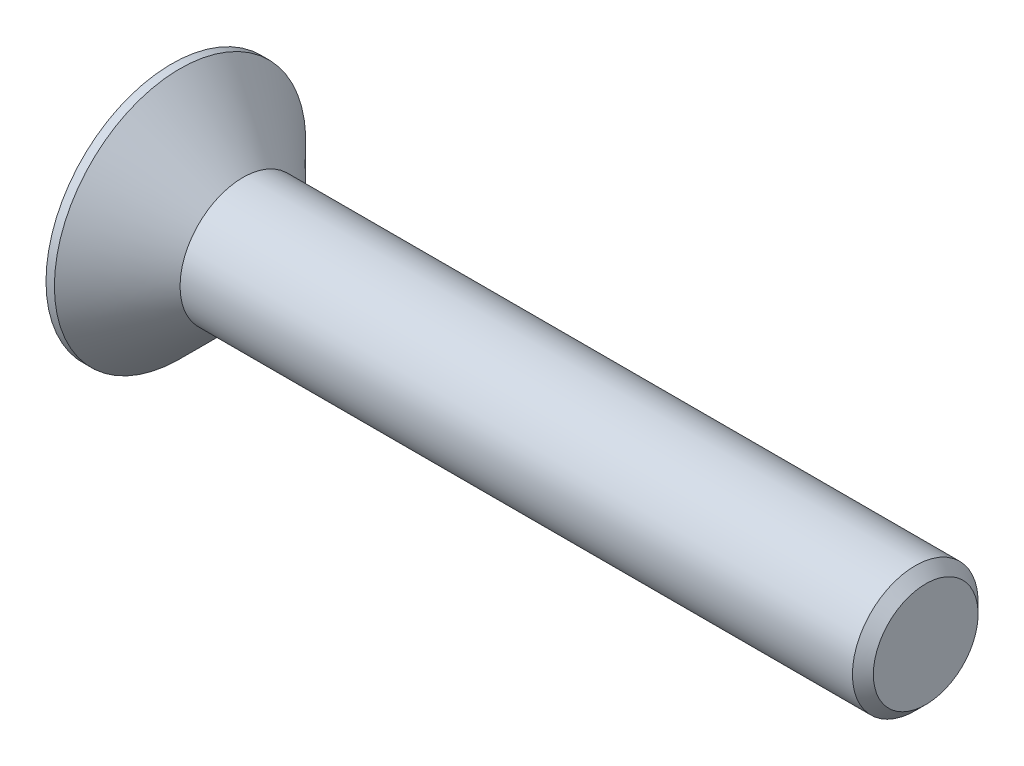
from build123d import *

# Parameters (mm, degrees)
CUT_EXTRUDE1_DEPTH = 0.8


with BuildPart() as part:
    # Sketch2 → Revolve1 (revolve)
    with BuildSketch(Plane.XY):
        Polygon((0, 0), (0, 3), (0.2, 3), (1.7, 1.5), (17.75, 1.5), (18, 1.25), (18, 0), align=None)
    revolve(axis=Axis((-2.281841559, 0, 0), (1, 0, 0)))

    # Sketch3 → Cut-Extrude1 (cut)
    with BuildSketch(Plane.ZY):
        Polygon((0.721687836, -1.25), (1.443375673, 0), (0.721687836, 1.25), (-0.721687836, 1.25), (-1.443375673, 0), (-0.721687836, -1.25), align=None)
    extrude(amount=-CUT_EXTRUDE1_DEPTH, mode=Mode.SUBTRACT)


solid = part.part
